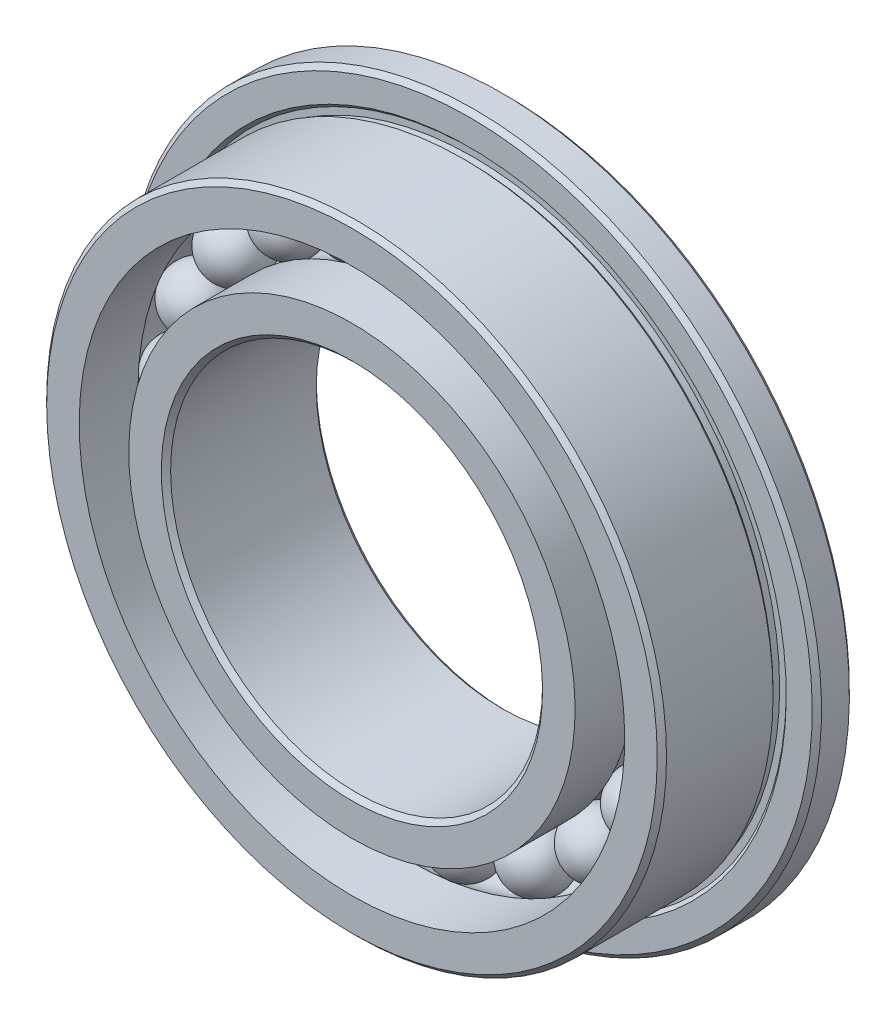
from build123d import *

# Parameters (mm, degrees)
FILLET1_SIZE      = 0.075
FILLET2_SIZE      = 0.075
CIRPATTERN3_COUNT = 21


with BuildPart() as part:
    # Sketch2 → Revolve1 (revolve)
    with BuildSketch(Plane(origin=(0, 0, 0), x_dir=(0, 0, -1), z_dir=(1, 0, 0))):
        with BuildLine():
            Line((1.25, 5.6), (0.65, 5.6))
            Line((0.65, 5.6), (0.65, 5.106066017))
            Line((0.65, 5.106066017), (0.703033009, 5.053033009))
            Line((0.703033009, 5.053033009), (0.703033009, 4.946966991))
            Line((0.703033009, 4.946966991), (0.596966991, 4.946966991))
            Line((0.596966991, 4.946966991), (0.543933983, 5))
            Line((0.543933983, 5), (-1.25, 5))
            Line((-1.25, 5), (-1.25, 4.4))
            Line((-1.25, 4.4), (-0.3, 4.4))
            ThreePointArc((-0.3, 4.4), (0, 4.5), (0.3, 4.4))
            Line((0.3, 4.4), (1.25, 4.4))
            Line((1.25, 4.4), (1.25, 5.6))
        make_face()
        with BuildLine():
            Line((1.25, 3), (-1.25, 3))
            Line((-1.25, 3), (-1.25, 3.6))
            Line((-1.25, 3.6), (-0.3, 3.6))
            ThreePointArc((-0.3, 3.6), (0, 3.5), (0.3, 3.6))
            Line((0.3, 3.6), (1.25, 3.6))
            Line((1.25, 3.6), (1.25, 3))
        make_face()
    revolve(axis=Axis((0, 0, 0), (0, 0, -1)))

    # Fillet1
    fillet1_edges = [part.edges().sort_by_distance(p)[0] for p in [
        (0, -5.6, -1.25),
        (0, -5.6, -0.65),
        (0, -5, 1.25),
    ]]
    chamfer(fillet1_edges, length=FILLET1_SIZE)

    # Fillet2
    fillet2_edges = [part.edges().sort_by_distance(p)[0] for p in [
        (0, -3, -1.25),
        (0, -3, 1.25),
    ]]
    chamfer(fillet2_edges, length=FILLET2_SIZE)


with BuildPart() as body_2:
    # Sketch7 → Revolve3 (revolve)
    with BuildSketch(Plane.XY):
        with BuildLine():
            Line((0, 4.5), (0, 3.5))
            ThreePointArc((0, 3.5), (-0.5, 4), (0, 4.5))
        make_face()
    revolve(axis=Axis((0, 4.5, 0), (0, -1, 0)))


with BuildPart() as cirpattern3_1:
    # CirPattern3: pattern copy
    add(body_2.part.rotate(Axis((0, 0, 0), (0, 0, -1)), 1 * 360 / CIRPATTERN3_COUNT))


with BuildPart() as cirpattern3_2:
    # CirPattern3: pattern copy
    add(body_2.part.rotate(Axis((0, 0, 0), (0, 0, -1)), 2 * 360 / CIRPATTERN3_COUNT))


with BuildPart() as cirpattern3_3:
    # CirPattern3: pattern copy
    add(body_2.part.rotate(Axis((0, 0, 0), (0, 0, -1)), 3 * 360 / CIRPATTERN3_COUNT))


with BuildPart() as cirpattern3_4:
    # CirPattern3: pattern copy
    add(body_2.part.rotate(Axis((0, 0, 0), (0, 0, -1)), 4 * 360 / CIRPATTERN3_COUNT))


with BuildPart() as cirpattern3_5:
    # CirPattern3: pattern copy
    add(body_2.part.rotate(Axis((0, 0, 0), (0, 0, -1)), 5 * 360 / CIRPATTERN3_COUNT))


with BuildPart() as cirpattern3_6:
    # CirPattern3: pattern copy
    add(body_2.part.rotate(Axis((0, 0, 0), (0, 0, -1)), 6 * 360 / CIRPATTERN3_COUNT))


with BuildPart() as cirpattern3_7:
    # CirPattern3: pattern copy
    add(body_2.part.rotate(Axis((0, 0, 0), (0, 0, -1)), 7 * 360 / CIRPATTERN3_COUNT))


with BuildPart() as cirpattern3_8:
    # CirPattern3: pattern copy
    add(body_2.part.rotate(Axis((0, 0, 0), (0, 0, -1)), 8 * 360 / CIRPATTERN3_COUNT))


with BuildPart() as cirpattern3_9:
    # CirPattern3: pattern copy
    add(body_2.part.rotate(Axis((0, 0, 0), (0, 0, -1)), 9 * 360 / CIRPATTERN3_COUNT))


with BuildPart() as cirpattern3_10:
    # CirPattern3: pattern copy
    add(body_2.part.rotate(Axis((0, 0, 0), (0, 0, -1)), 10 * 360 / CIRPATTERN3_COUNT))


with BuildPart() as cirpattern3_11:
    # CirPattern3: pattern copy
    add(body_2.part.rotate(Axis((0, 0, 0), (0, 0, -1)), 11 * 360 / CIRPATTERN3_COUNT))


with BuildPart() as cirpattern3_12:
    # CirPattern3: pattern copy
    add(body_2.part.rotate(Axis((0, 0, 0), (0, 0, -1)), 12 * 360 / CIRPATTERN3_COUNT))


with BuildPart() as cirpattern3_13:
    # CirPattern3: pattern copy
    add(body_2.part.rotate(Axis((0, 0, 0), (0, 0, -1)), 13 * 360 / CIRPATTERN3_COUNT))


with BuildPart() as cirpattern3_14:
    # CirPattern3: pattern copy
    add(body_2.part.rotate(Axis((0, 0, 0), (0, 0, -1)), 14 * 360 / CIRPATTERN3_COUNT))


with BuildPart() as cirpattern3_15:
    # CirPattern3: pattern copy
    add(body_2.part.rotate(Axis((0, 0, 0), (0, 0, -1)), 15 * 360 / CIRPATTERN3_COUNT))


with BuildPart() as cirpattern3_16:
    # CirPattern3: pattern copy
    add(body_2.part.rotate(Axis((0, 0, 0), (0, 0, -1)), 16 * 360 / CIRPATTERN3_COUNT))


with BuildPart() as cirpattern3_17:
    # CirPattern3: pattern copy
    add(body_2.part.rotate(Axis((0, 0, 0), (0, 0, -1)), 17 * 360 / CIRPATTERN3_COUNT))


with BuildPart() as cirpattern3_18:
    # CirPattern3: pattern copy
    add(body_2.part.rotate(Axis((0, 0, 0), (0, 0, -1)), 18 * 360 / CIRPATTERN3_COUNT))


with BuildPart() as cirpattern3_19:
    # CirPattern3: pattern copy
    add(body_2.part.rotate(Axis((0, 0, 0), (0, 0, -1)), 19 * 360 / CIRPATTERN3_COUNT))


with BuildPart() as cirpattern3_20:
    # CirPattern3: pattern copy
    add(body_2.part.rotate(Axis((0, 0, 0), (0, 0, -1)), 20 * 360 / CIRPATTERN3_COUNT))


solid = Compound([part.part, body_2.part, cirpattern3_1.part, cirpattern3_2.part, cirpattern3_3.part, cirpattern3_4.part, cirpattern3_5.part, cirpattern3_6.part, cirpattern3_7.part, cirpattern3_8.part, cirpattern3_9.part, cirpattern3_10.part, cirpattern3_11.part, cirpattern3_12.part, cirpattern3_13.part, cirpattern3_14.part, cirpattern3_15.part, cirpattern3_16.part, cirpattern3_17.part, cirpattern3_18.part, cirpattern3_19.part, cirpattern3_20.part])
